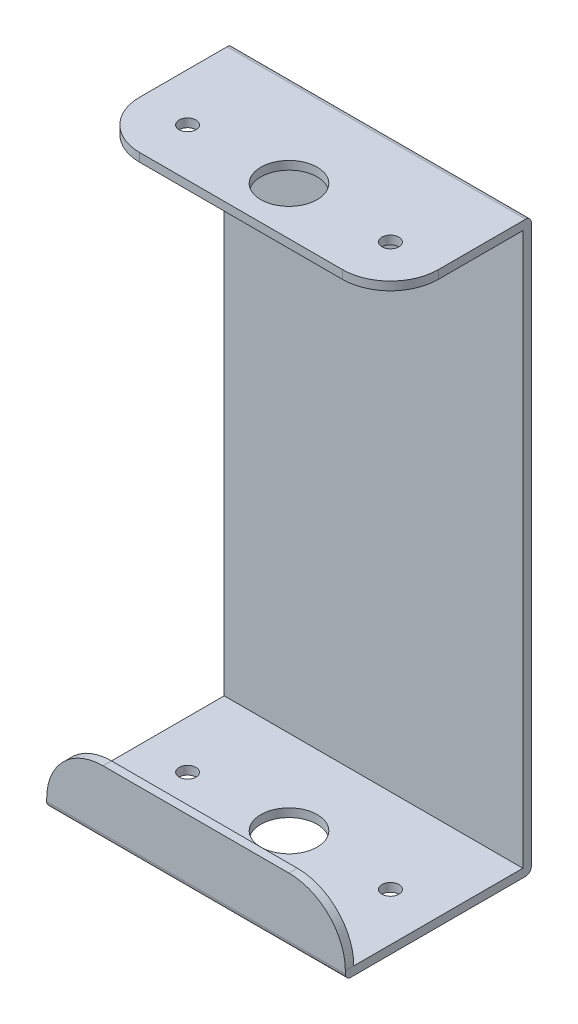
from build123d import *

# Parameters (mm, degrees)
SKETCH1_W               = 53
SKETCH1_H               = 101
BOSS_EXTRUDE1_DEPTH     = 1.5
SKETCH5_W               = 53
SKETCH5_H               = 1.5
BOSS_EXTRUDE2_DEPTH     = 31.5
SKETCH3_W               = 53
SKETCH3_H               = 1.5
EXTRUDE_THIN3_DEPTH     = 31.5
SKETCH6_W               = 53
SKETCH6_H               = 1.5
BOSS_EXTRUDE3_DEPTH     = 10
CUT_EXTRUDE3_DEPTH      = 10
FILLET1_R               = 1
CUT_EXTRUDE4_DEPTH      = 10
FILLET2_R               = 1
FILLET3_R               = 1
CUT_EXTRUDE5_DEPTH      = 10
CUT_EXTRUDE6_DEPTH      = 73.29497691
CUT_EXTRUDE6_DEPTH_BACK = 10
CUT_EXTRUDE8_START      = -1.5
CUT_EXTRUDE8_DEPTH      = 1.5


# Read off the part's stored shape, not the designer's step: Cut-Extrude8
with BuildPart() as part:
    # Sketch1 → Boss-Extrude1 (new body)
    with BuildSketch(Plane.XY):
        with Locations((-8.895027996, 3.209921613)):
            Rectangle(SKETCH1_W, SKETCH1_H)
    extrude(amount=BOSS_EXTRUDE1_DEPTH)

    # Sketch5 → Boss-Extrude2 (add)
    with BuildSketch(Plane.XY.offset(1.5)):
        with Locations((-8.895027996, 52.959921613)):
            Rectangle(SKETCH5_W, SKETCH5_H)
    extrude(amount=BOSS_EXTRUDE2_DEPTH)

    # Sketch3 → Extrude-Thin3 (add)
    with BuildSketch(Plane.XY.offset(1.5)):
        with Locations((-8.895027996, -46.540078387)):
            Rectangle(SKETCH3_W, SKETCH3_H)
    extrude(amount=EXTRUDE_THIN3_DEPTH)

    # Sketch6 → Boss-Extrude3 (add)
    with BuildSketch(Plane(origin=(0, -45.790078387, 0), x_dir=(1, 0, 0), z_dir=(0, 1, 0))):
        with Locations((-8.895027996, -32.25)):
            Rectangle(SKETCH6_W, SKETCH6_H)
    extrude(amount=BOSS_EXTRUDE3_DEPTH)

    # Sketch7 → Cut-Extrude3 (cut)
    with BuildSketch(Plane(origin=(0, 53.709921613, 0), x_dir=(1, 0, 0), z_dir=(0, 1, 0))):
        with BuildLine():
            ThreePointArc((-3.895027996, -16.5), (-7.520695926, -11.692587873), (-13.13951254, -13.857207736))
            Line((-13.13951254, -13.857207736), (-8.895027996, -16.5))
            Line((-8.895027996, -16.5), (-3.895027996, -16.5))
        make_face()
        with BuildLine():
            Line((-8.895027996, -16.5), (-13.13951254, -13.857207736))
            ThreePointArc((-13.13951254, -13.857207736), (-13.702440123, -15.12566793), (-13.895027996, -16.5))
            Line((-13.895027996, -16.5), (-8.895027996, -16.5))
        make_face()
        with BuildLine():
            Line((-3.895027996, -16.5), (-8.895027996, -16.5))
            Line((-8.895027996, -16.5), (-4.650543451, -19.142792264))
            ThreePointArc((-4.650543451, -19.142792264), (-4.087615868, -17.87433207), (-3.895027996, -16.5))
        make_face()
        with BuildLine():
            Line((-4.650543451, -19.142792264), (-8.895027996, -16.5))
            Line((-8.895027996, -16.5), (-13.895027996, -16.5))
            ThreePointArc((-13.895027996, -16.5), (-10.269360065, -21.307412127), (-4.650543451, -19.142792264))
        make_face()
        with BuildLine():
            ThreePointArc((10.604972004, -16.5), (9.104972004, -15), (7.604972004, -16.5))
            Line((7.604972004, -16.5), (10.604972004, -16.5))
        make_face()
        with BuildLine():
            Line((10.604972004, -16.5), (7.604972004, -16.5))
            ThreePointArc((7.604972004, -16.5), (9.104972004, -18), (10.604972004, -16.5))
        make_face()
        with BuildLine():
            ThreePointArc((-28.395027996, -16.5), (-26.895027996, -18), (-25.395027996, -16.5))
            Line((-25.395027996, -16.5), (-28.395027996, -16.5))
        make_face()
        with BuildLine():
            Line((-28.395027996, -16.5), (-25.395027996, -16.5))
            ThreePointArc((-25.395027996, -16.5), (-26.895027996, -15), (-28.395027996, -16.5))
        make_face()
    extrude(amount=-CUT_EXTRUDE3_DEPTH, mode=Mode.SUBTRACT)

    # Fillet1
    fillet1_edges = [part.edges().sort_by_distance(p)[0] for p in [
        (-8.895027996, 53.709921613, 0),
    ]]
    fillet(fillet1_edges, radius=FILLET1_R)

    # Sketch8 → Cut-Extrude4 (cut)
    with BuildSketch(Plane(origin=(0, -45.790078387, 0), x_dir=(1, 0, 0), z_dir=(0, 1, 0))):
        with BuildLine():
            ThreePointArc((-3.895027996, -16.5), (-7.621533075, -11.664898068), (-13.246312271, -14.037008901))
            Line((-13.246312271, -14.037008901), (-8.895027996, -16.5))
            Line((-8.895027996, -16.5), (-3.895027996, -16.5))
        make_face()
        with BuildLine():
            Line((-8.895027996, -16.5), (-13.246312271, -14.037008901))
            ThreePointArc((-13.246312271, -14.037008901), (-13.730129927, -15.22650508), (-13.895027996, -16.5))
            Line((-13.895027996, -16.5), (-8.895027996, -16.5))
        make_face()
        with BuildLine():
            Line((-3.895027996, -16.5), (-8.895027996, -16.5))
            Line((-8.895027996, -16.5), (-4.54374372, -18.962991099))
            ThreePointArc((-4.54374372, -18.962991099), (-4.059926064, -17.77349492), (-3.895027996, -16.5))
        make_face()
        with BuildLine():
            Line((-4.54374372, -18.962991099), (-8.895027996, -16.5))
            Line((-8.895027996, -16.5), (-13.895027996, -16.5))
            ThreePointArc((-13.895027996, -16.5), (-10.168522916, -21.335101932), (-4.54374372, -18.962991099))
        make_face()
        with BuildLine():
            ThreePointArc((-28.395027996, -16.5), (-26.895027996, -18), (-25.395027996, -16.5))
            Line((-25.395027996, -16.5), (-28.395027996, -16.5))
        make_face()
        with BuildLine():
            Line((-28.395027996, -16.5), (-25.395027996, -16.5))
            ThreePointArc((-25.395027996, -16.5), (-26.895027996, -15), (-28.395027996, -16.5))
        make_face()
        with BuildLine():
            ThreePointArc((10.604972004, -16.5), (9.104972004, -15), (7.604972004, -16.5))
            Line((7.604972004, -16.5), (10.604972004, -16.5))
        make_face()
        with BuildLine():
            Line((10.604972004, -16.5), (7.604972004, -16.5))
            ThreePointArc((7.604972004, -16.5), (9.104972004, -18), (10.604972004, -16.5))
        make_face()
    extrude(amount=-CUT_EXTRUDE4_DEPTH, mode=Mode.SUBTRACT)

    # Fillet2
    fillet2_edges = [part.edges().sort_by_distance(p)[0] for p in [
        (-8.895027996, -47.290078387, 0),
    ]]
    fillet(fillet2_edges, radius=FILLET2_R)

    # Fillet3
    fillet3_edges = [part.edges().sort_by_distance(p)[0] for p in [
        (-8.895027996, -47.290078387, 33),
    ]]
    fillet(fillet3_edges, radius=FILLET3_R)

    # Sketch10 → Cut-Extrude5 (cut)
    with BuildSketch(Plane(origin=(0, 53.709921613, 0), x_dir=(1, 0, 0), z_dir=(0, 1, 0))):
        with BuildLine():
            Line((9.104972004, -25), (-26.895027996, -25))
            ThreePointArc((-26.895027996, -25), (-32.905435636, -22.51040764), (-35.395027996, -16.5))
            Line((-35.395027996, -16.5), (-35.395027996, -33))
            Line((-35.395027996, -33), (17.604972004, -33))
            Line((17.604972004, -33), (17.604972004, -16.5))
            ThreePointArc((17.604972004, -16.5), (15.115379645, -22.51040764), (9.104972004, -25))
        make_face()
    extrude(amount=-CUT_EXTRUDE5_DEPTH, mode=Mode.SUBTRACT)

    # Sketch11 → Cut-Extrude6 (cut, two sides: drawn at the far end of the back side and taken through both)
    with BuildSketch(Plane.XY.offset(33).offset(-CUT_EXTRUDE6_DEPTH_BACK)):
        with BuildLine():
            Line((-35.395027996, -35.790078387), (-35.395027996, -45.790078387))
            ThreePointArc((-35.395027996, -45.790078387), (-32.466095807, -38.719010576), (-25.395027996, -35.790078387))
            Line((-25.395027996, -35.790078387), (-35.395027996, -35.790078387))
        make_face()
    extrude(amount=CUT_EXTRUDE6_DEPTH + CUT_EXTRUDE6_DEPTH_BACK, mode=Mode.SUBTRACT)

    # Cut-Extrude8 outline → Cut-Extrude8 (cut)
    with BuildSketch(Plane.XY.offset(33).offset(CUT_EXTRUDE8_START)):
        with BuildLine():
            Line((17.604972004, -35.790078387), (7.604972004, -35.790078387))
            ThreePointArc((7.604972004, -35.790078387), (14.676039815, -38.719010576), (17.604972004, -45.790078387))
            Line((17.604972004, -45.790078387), (17.604972004, -35.790078387))
        make_face()
    extrude(amount=CUT_EXTRUDE8_DEPTH, mode=Mode.SUBTRACT)


solid = part.part
